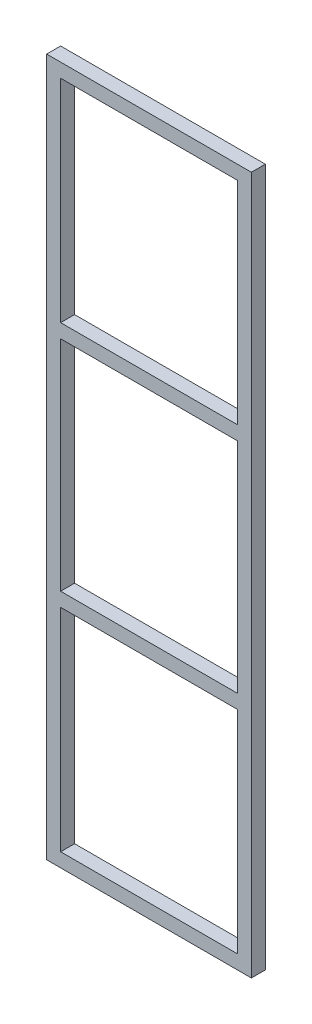
from build123d import *

# Parameters (mm, degrees)
SKETCH1_W           = 88
SKETCH1_H           = 300
SKETCH1_W_2         = 76
SKETCH1_H_2         = 91
SKETCH1_H_3         = 94
BOSS_EXTRUDE1_DEPTH = 6


with BuildPart() as part:
    # Sketch1 → Boss-Extrude1 (new body)
    with BuildSketch(Plane.XY):
        with Locations((6, 0)):
            Rectangle(SKETCH1_W, SKETCH1_H)
        with Locations((6, 98.5)):
            Rectangle(SKETCH1_W_2, SKETCH1_H_2, mode=Mode.SUBTRACT)
        with Locations((6, -98.5)):
            Rectangle(SKETCH1_W_2, SKETCH1_H_2, mode=Mode.SUBTRACT)
        with Locations((6, 0)):
            Rectangle(SKETCH1_W_2, SKETCH1_H_3, mode=Mode.SUBTRACT)
    extrude(amount=BOSS_EXTRUDE1_DEPTH)


solid = part.part
